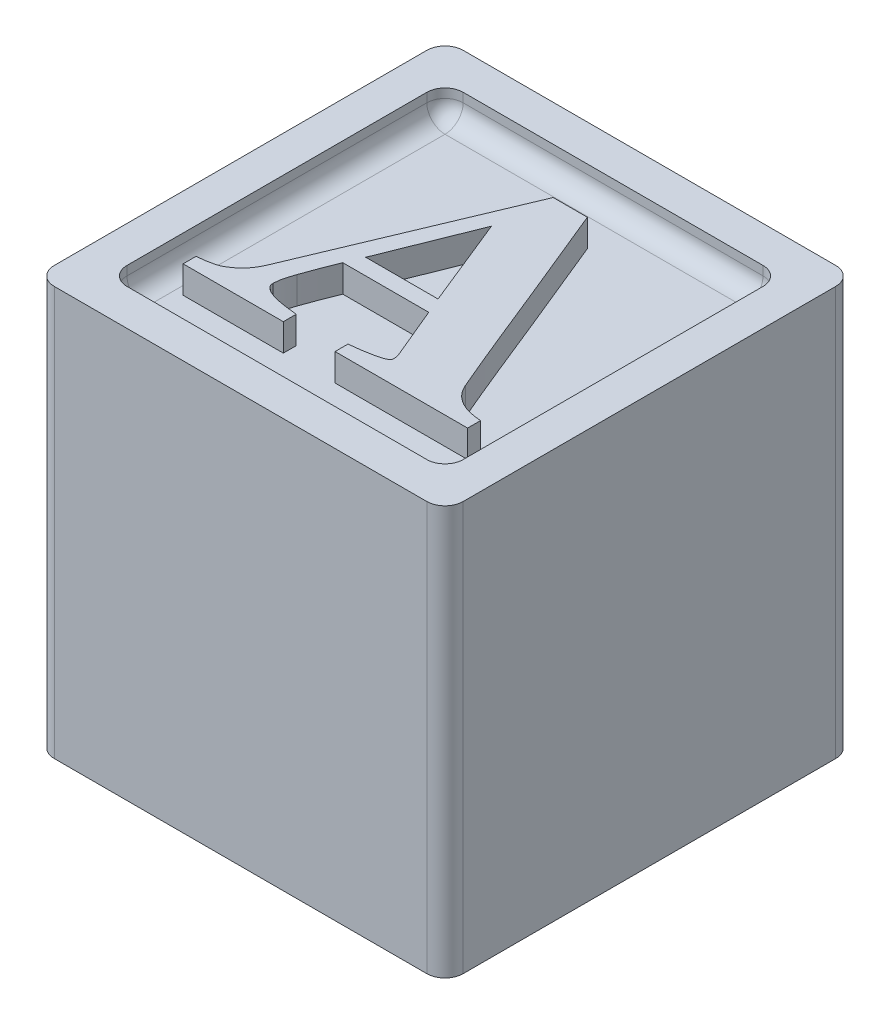
from build123d import *

# Parameters (mm, degrees)
SKETCH1_W           = 45
SKETCH1_H           = 45
BOSS_EXTRUDE1_DEPTH = 45
CUT_EXTRUDE1_DEPTH  = 3
FILLET1_R           = 2
BOSS_EXTRUDE2_DEPTH = 3
FILLET2_R           = 2
FILLET3_R           = 2


with BuildPart() as part:
    # Sketch1 → Boss-Extrude1 (new body)
    with BuildSketch(Plane(origin=(0, 0, 0), x_dir=(1, 0, 0), z_dir=(0, 1, 0))):
        with Locations((22.5, 22.5)):
            Rectangle(SKETCH1_W, SKETCH1_H)
    extrude(amount=BOSS_EXTRUDE1_DEPTH)

    # Sketch2 → Cut-Extrude1 (cut)
    with BuildSketch(Plane(origin=(0, 45, 0), x_dir=(1, 0, 0), z_dir=(0, 1, 0))):
        with BuildLine():
            Line((6, 41), (39, 41))
            ThreePointArc((39, 41), (40.414213562, 40.414213562), (41, 39))
            Line((41, 39), (41, 6))
            ThreePointArc((41, 6), (40.414213562, 4.585786438), (39, 4))
            Line((39, 4), (6, 4))
            ThreePointArc((6, 4), (4.585786438, 4.585786438), (4, 6))
            Line((4, 6), (4, 39))
            ThreePointArc((4, 39), (4.585786438, 40.414213562), (6, 41))
        make_face()
    extrude(amount=-CUT_EXTRUDE1_DEPTH, mode=Mode.SUBTRACT)

    # Fillet1
    fillet1_edges = [part.edges().sort_by_distance(p)[0] for p in [
        (41, 42, -22.5),
        (40.414213562, 42, -4.585786438),
        (22.5, 42, -4),
        (4.585786438, 42, -4.585786438),
        (4, 42, -22.5),
        (4.585786438, 42, -40.414213562),
        (22.5, 42, -41),
        (40.414213562, 42, -40.414213562),
    ]]
    fillet(fillet1_edges, radius=FILLET1_R)

    # Sketch3 → Boss-Extrude2 (add)
    with BuildSketch(Plane(origin=(0, 42, 0), x_dir=(1, 0, 0), z_dir=(0, 1, 0))):
        with BuildLine():
            Line((38.242693353, 9.243196233), (23.656388738, 9.243196233))
            Line((23.656388738, 9.243196233), (23.656388738, 10.666250342))
            add(Edge.make_bspline(
                [(23.656388738, 10.666250342), (23.840076099, 10.68078989), (24.225242332, 10.711277253), (24.822230957, 10.802993535), (25.469379926, 10.895689338), (26.022940834, 11.010248275), (26.463008214, 11.096809674), (26.751861609, 11.185019051), (27.001950694, 11.262002653), (27.202632415, 11.353541525), (27.365753511, 11.438699124), (27.476844631, 11.539421658), (27.55548257, 11.642841951), (27.565194032, 11.719511547), (27.569787537, 11.755776144)],
                knots=[0, 0, 0, 0, 1.580663375, 3.314425972, 5.180984338, 7.189265601, 8.165445891, 9.025996966, 9.780234646, 10.406650621, 10.91943364, 11.347278432, 11.691263739, 12, 12, 12, 12], degree=3))
            add(Edge.make_bspline(
                [(27.569787537, 11.755776144), (27.569435107, 11.809650716), (27.568689302, 11.923658657), (27.533827132, 12.110664377), (27.487076537, 12.345104426), (27.419571412, 12.510976182), (27.380788164, 12.606273326)],
                knots=[0, 0, 0, 0, 0.735694078, 1.556856296, 2.596357679, 4, 4, 4, 4], degree=3))
            Line((27.380788164, 12.606273326), (25.073884042, 18.137284413))
            Line((25.073884042, 18.137284413), (15.618356546, 18.137284413))
            add(Edge.make_bspline(
                [(15.618356546, 18.137284413), (15.504836551, 17.857690943), (15.261095281, 17.257369675), (14.897005839, 16.330696191), (14.552517174, 15.390865424), (14.332060663, 14.774334183), (14.228655267, 14.485149454)],
                knots=[0, 0, 0, 0, 0.926583958, 1.989488725, 3.056967239, 4, 4, 4, 4], degree=3))
            add(Edge.make_bspline(
                [(14.228655267, 14.485149454), (14.174323811, 14.322282922), (14.073992132, 14.021523953), (13.944497555, 13.605517058), (13.852124744, 13.261079178), (13.790356149, 12.921159244), (13.757506332, 12.61062748), (13.744527557, 12.391364177), (13.739480418, 12.30609785)],
                knots=[0, 0, 0, 0, 1.377792625, 2.544313332, 3.496463908, 4.237287142, 5.314522549, 6, 6, 6, 6], degree=3))
            add(Edge.make_bspline(
                [(13.739480418, 12.30609785), (13.752275343, 12.20703328), (13.779291631, 11.997859957), (13.987544963, 11.717644303), (14.302946626, 11.47080153), (14.743758449, 11.250468253), (15.325360636, 11.057952059), (16.061834345, 10.898701284), (16.958602595, 10.761686661), (17.611688564, 10.699703767), (17.964172303, 10.666250342)],
                knots=[0, 0, 0, 0, 0.491092674, 1.036934666, 1.680532576, 2.482252872, 3.47863382, 4.729366136, 6.234772593, 8, 8, 8, 8], degree=3))
            Line((17.964172303, 10.666250342), (17.964172303, 9.243196233))
            Line((17.964172303, 9.243196233), (6.93550296, 9.243196233))
            Line((6.93550296, 9.243196233), (6.93550296, 10.666250342))
            add(Edge.make_bspline(
                [(6.93550296, 10.666250342), (7.156458841, 10.68507928), (7.626766221, 10.725156912), (8.214255419, 10.83449568), (8.694916504, 10.934535131), (9.021428402, 11.044189086), (9.31379367, 11.154502307), (9.484333571, 11.253318866), (9.564817778, 11.299954125)],
                knots=[0, 0, 0, 0, 1.463204883, 3.114450051, 3.942471061, 4.700769028, 5.386843935, 6, 6, 6, 6], degree=3))
            add(Edge.make_bspline(
                [(9.564817778, 11.299954125), (9.808806898, 11.456132653), (10.289617679, 11.763901787), (10.894760398, 12.38121249), (11.401516748, 13.103822817), (11.641967893, 13.651883003), (11.766104603, 13.934827748)],
                knots=[0, 0, 0, 0, 0.990620078, 1.952139562, 2.94275964, 4, 4, 4, 4], degree=3))
            add(Edge.make_bspline(
                [(11.766104603, 13.934827748), (12.49384773, 15.674926569), (13.950269602, 19.157361354), (15.787937069, 23.531851641), (17.281093989, 27.110474834), (18.468273477, 29.928542487), (19.704638443, 32.883483751), (20.55061589, 34.89718826), (20.982603479, 35.925460773)],
                knots=[0, 0, 0, 0, 1.423871405, 2.8495734, 3.581899029, 4.351134106, 5.15802767, 6, 6, 6, 6], degree=3))
            Line((20.982603479, 35.925460773), (24.740355735, 35.925460773))
            add(Edge.make_bspline(
                [(24.740355735, 35.925460773), (25.037951878, 35.198811204), (25.616719472, 33.785616739), (26.473021768, 31.729065196), (27.262884583, 29.784355708), (28.012276259, 27.959201793), (28.701657163, 26.247813786), (29.358282986, 24.658333454), (29.948553903, 23.180808533), (30.499990304, 21.811943928), (31.011657569, 20.529416983), (31.511007395, 19.316516594), (31.980152709, 18.154453259), (32.436507788, 17.051074697), (32.870912199, 16.001880065), (33.286642483, 15.010835315), (33.682273223, 14.072862205), (33.941746737, 13.467767085), (34.068030714, 13.173271448)],
                knots=[0, 0, 0, 0, 1.532752056, 2.980909665, 4.348409991, 5.629937521, 6.832191988, 7.949838466, 8.98685575, 9.937901843, 10.830515139, 11.682178711, 12.498237346, 13.276712205, 14.012891946, 14.714850756, 15.374526692, 16, 16, 16, 16], degree=3))
            add(Edge.make_bspline(
                [(34.068030714, 13.173271448), (34.156473839, 12.994922089), (34.332453747, 12.640051048), (34.679517564, 12.137203398), (35.154116348, 11.674345926), (35.54643409, 11.431082086), (35.757907468, 11.299954125)],
                knots=[0, 0, 0, 0, 0.929211814, 1.848901312, 2.840480417, 4, 4, 4, 4], degree=3))
            add(Edge.make_bspline(
                [(35.757907468, 11.299954125), (35.94634352, 11.206794224), (36.337568372, 11.013378643), (36.978994102, 10.838934171), (37.620953448, 10.729278261), (38.044146103, 10.686377762), (38.242693353, 10.666250342)],
                knots=[0, 0, 0, 0, 0.974847381, 2.023946679, 3.072904627, 4, 4, 4, 4], degree=3))
            Line((38.242693353, 10.666250342), (38.242693353, 9.243196233))
        make_face()
        Polygon((24.317886547, 19.916102049), (20.315546866, 29.799657539), (16.357677626, 19.916102049), align=None, mode=Mode.SUBTRACT)
    extrude(amount=BOSS_EXTRUDE2_DEPTH)

    # Fillet2
    fillet2_edges = [part.edges().sort_by_distance(p)[0] for p in [
        (45, 22.5, -45),
        (45, 22.5, 0),
        (0, 22.5, 0),
    ]]
    fillet(fillet2_edges, radius=FILLET2_R)

    # Fillet3
    fillet3_edges = [part.edges().sort_by_distance(p)[0] for p in [
        (0, 22.5, -45),
    ]]
    fillet(fillet3_edges, radius=FILLET3_R)


solid = part.part
